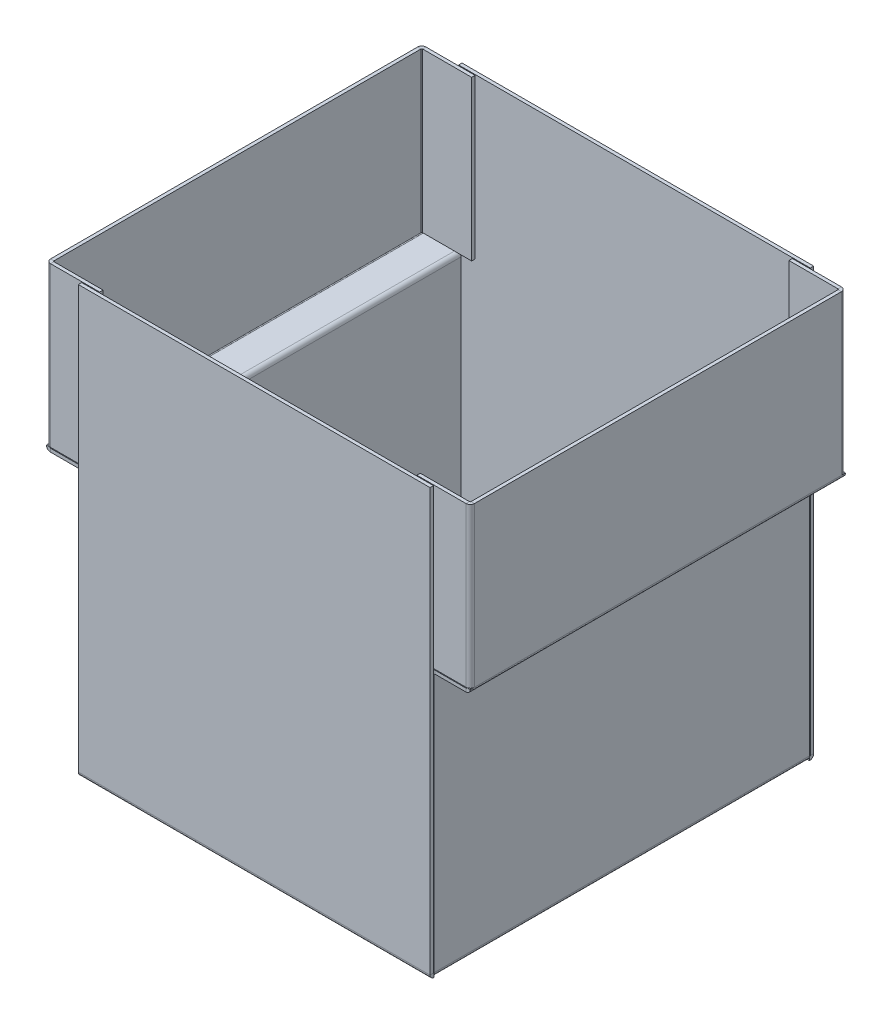
from build123d import *

# Parameters (mm, degrees)
SKETCH6_W                       = 330
SKETCH6_H                       = 360
BASE_FLANGE2_DEPTH              = 3.175
EDGE_FLANGE4_STRIP_W            = 14.1732
EDGE_FLANGE4_STRIP_H            = 3.175
EDGE_FLANGE4_STRIP_CUT_DEPTH    = 330
EDGE_FLANGE4_DEPTH              = 330
EDGE_FLANGE5_STRIP_W            = 14.1732
EDGE_FLANGE5_STRIP_H            = 3.175
EDGE_FLANGE5_STRIP_CUT_DEPTH    = 330
EDGE_FLANGE5_DEPTH              = 330
EDGE_FLANGE6_STRIP_W            = 14.1732
EDGE_FLANGE6_STRIP_H            = 3.175
EDGE_FLANGE6_STRIP_CUT_DEPTH    = 352.1768
EDGE_FLANGE6_DEPTH              = 352.1768
EDGE_FLANGE7_STRIP_W            = 14.1732
EDGE_FLANGE7_STRIP_H            = 3.175
EDGE_FLANGE7_STRIP_CUT_DEPTH    = 352.1768
EDGE_FLANGE7_DEPTH              = 352.1768
EDGE_FLANGE10_STRIP_W           = 14.1732
EDGE_FLANGE10_STRIP_H           = 3.175
EDGE_FLANGE10_STRIP_CUT_DEPTH   = 352.1768
EDGE_FLANGE10_DEPTH             = 352.1768
EDGE_FLANGE11_STRIP_W           = 14.1732
EDGE_FLANGE11_STRIP_H           = 3.175
EDGE_FLANGE11_STRIP_CUT_DEPTH   = 352.1768
EDGE_FLANGE11_DEPTH             = 352.1768
EDGE_FLANGE12_STRIP_W           = 14.1732
EDGE_FLANGE12_STRIP_H           = 3.175
EDGE_FLANGE12_STRIP_CUT_DEPTH   = 352.1768
EDGE_FLANGE12_DEPTH             = 352.1768
EDGE_FLANGE13_STRIP_W           = 14.1732
EDGE_FLANGE13_STRIP_H           = 3.175
EDGE_FLANGE13_STRIP_CUT_DEPTH   = 352.1768
EDGE_FLANGE13_DEPTH             = 352.1768
EDGE_FLANGE14_STRIP_W           = 14.1732
EDGE_FLANGE14_STRIP_H           = 3.175
EDGE_FLANGE14_STRIP_CUT_DEPTH   = 149.2684
EDGE_FLANGE14_STRIP_2_W         = 14.1732
EDGE_FLANGE14_STRIP_2_H         = 3.175
EDGE_FLANGE14_STRIP_CUT_2_DEPTH = 149.2684
EDGE_FLANGE14_STRIP_3_W         = 14.1732
EDGE_FLANGE14_STRIP_3_H         = 3.175
EDGE_FLANGE14_STRIP_CUT_3_DEPTH = 149.2684
EDGE_FLANGE14_STRIP_4_W         = 14.1732
EDGE_FLANGE14_STRIP_4_H         = 3.175
EDGE_FLANGE14_STRIP_CUT_4_DEPTH = 149.2684
EDGE_FLANGE14_DEPTH             = 149.2684
EDGE_FLANGE14_BEND_DEPTH        = 149.2684
EDGE_FLANGE14_BEND_2_DEPTH      = 149.2684
EDGE_FLANGE14_BEND_3_DEPTH      = 149.2684


# Sheet-metal steps are written as plain solids
with BuildPart() as part:
    # Sketch6 → Base-Flange2 (new body)
    with BuildSketch(Plane(origin=(0, 0, 0), x_dir=(1, 0, 0), z_dir=(0, 1, 0))):
        Rectangle(SKETCH6_W, SKETCH6_H)
    extrude(amount=-BASE_FLANGE2_DEPTH)

    # Edge-Flange4 strip (across the edge) → Edge-Flange4 strip cut (cut)
    with BuildSketch(Plane(origin=(-165, 0, 180), x_dir=(0, 0, -1), z_dir=(1, 0, 0))):
        with Locations((-3.175, -1.5875)):
            Rectangle(EDGE_FLANGE4_STRIP_W, EDGE_FLANGE4_STRIP_H)
    extrude(amount=EDGE_FLANGE4_STRIP_CUT_DEPTH, mode=Mode.SUBTRACT)

    # Edge-Flange4 section (across the edge) → Edge-Flange4 (add)
    with BuildSketch(Plane(origin=(-165, 0, 180), x_dir=(0, 0, -1), z_dir=(1, 0, 0))):
        with BuildLine():
            Line((0, 0.7366), (0, 396.825))
            Line((0, 396.825), (3.175, 396.825))
            Line((3.175, 396.825), (3.175, 0.7366))
            ThreePointArc((3.175, 0.7366), (3.390745145, 0.215745145), (3.9116, 0))
            Line((3.9116, 0), (3.9116, -3.175))
            ThreePointArc((3.9116, -3.175), (1.145681115, -2.029318885), (0, 0.7366))
        make_face()
    extrude(amount=EDGE_FLANGE4_DEPTH)

    # Edge-Flange5 strip (across the edge) → Edge-Flange5 strip cut (cut)
    with BuildSketch(Plane(origin=(165, 0, -180), x_dir=(0, 0, 1), z_dir=(-1, 0, 0))):
        with Locations((-3.175, -1.5875)):
            Rectangle(EDGE_FLANGE5_STRIP_W, EDGE_FLANGE5_STRIP_H)
    extrude(amount=EDGE_FLANGE5_STRIP_CUT_DEPTH, mode=Mode.SUBTRACT)

    # Edge-Flange5 section (across the edge) → Edge-Flange5 (add)
    with BuildSketch(Plane(origin=(165, 0, -180), x_dir=(0, 0, 1), z_dir=(-1, 0, 0))):
        with BuildLine():
            Line((0, 0.7366), (0, 396.825))
            Line((0, 396.825), (3.175, 396.825))
            Line((3.175, 396.825), (3.175, 0.7366))
            ThreePointArc((3.175, 0.7366), (3.390745145, 0.215745145), (3.9116, 0))
            Line((3.9116, 0), (3.9116, -3.175))
            ThreePointArc((3.9116, -3.175), (1.145681115, -2.029318885), (0, 0.7366))
        make_face()
    extrude(amount=EDGE_FLANGE5_DEPTH)

    # Edge-Flange6 strip (across the edge) → Edge-Flange6 strip cut (cut)
    with BuildSketch(Plane(origin=(165, 0, 176.0884), x_dir=(-1, 0, 0), z_dir=(0, 0, -1))):
        with Locations((-3.175, -1.5875)):
            Rectangle(EDGE_FLANGE6_STRIP_W, EDGE_FLANGE6_STRIP_H)
    extrude(amount=EDGE_FLANGE6_STRIP_CUT_DEPTH, mode=Mode.SUBTRACT)

    # Edge-Flange6 section (across the edge) → Edge-Flange6 (add)
    with BuildSketch(Plane(origin=(165, 0, 176.0884), x_dir=(-1, 0, 0), z_dir=(0, 0, -1))):
        with BuildLine():
            Line((0, 0.7366), (0, 246.825))
            Line((0, 246.825), (3.175, 246.825))
            Line((3.175, 246.825), (3.175, 0.7366))
            ThreePointArc((3.175, 0.7366), (3.390745145, 0.215745145), (3.9116, 0))
            Line((3.9116, 0), (3.9116, -3.175))
            ThreePointArc((3.9116, -3.175), (1.145681115, -2.029318885), (0, 0.7366))
        make_face()
    extrude(amount=EDGE_FLANGE6_DEPTH)

    # Edge-Flange7 strip (across the edge) → Edge-Flange7 strip cut (cut)
    with BuildSketch(Plane(origin=(-165, 0, -176.0884), x_dir=(1, 0, 0), z_dir=(0, 0, 1))):
        with Locations((-3.175, -1.5875)):
            Rectangle(EDGE_FLANGE7_STRIP_W, EDGE_FLANGE7_STRIP_H)
    extrude(amount=EDGE_FLANGE7_STRIP_CUT_DEPTH, mode=Mode.SUBTRACT)

    # Edge-Flange7 section (across the edge) → Edge-Flange7 (add)
    with BuildSketch(Plane(origin=(-165, 0, -176.0884), x_dir=(1, 0, 0), z_dir=(0, 0, 1))):
        with BuildLine():
            Line((0, 0.7366), (0, 246.825))
            Line((0, 246.825), (3.175, 246.825))
            Line((3.175, 246.825), (3.175, 0.7366))
            ThreePointArc((3.175, 0.7366), (3.390745145, 0.215745145), (3.9116, 0))
            Line((3.9116, 0), (3.9116, -3.175))
            ThreePointArc((3.9116, -3.175), (1.145681115, -2.029318885), (0, 0.7366))
        make_face()
    extrude(amount=EDGE_FLANGE7_DEPTH)

    # Edge-Flange10 strip (across the edge) → Edge-Flange10 strip cut (cut)
    with BuildSketch(Plane(origin=(-165, 246.825, 176.0884), x_dir=(0, -1, 0), z_dir=(0, 0, -1))):
        with Locations((-3.175, -1.5875)):
            Rectangle(EDGE_FLANGE10_STRIP_W, EDGE_FLANGE10_STRIP_H)
    extrude(amount=EDGE_FLANGE10_STRIP_CUT_DEPTH, mode=Mode.SUBTRACT)

    # Edge-Flange10 section (across the edge) → Edge-Flange10 (add)
    with BuildSketch(Plane(origin=(-165, 246.825, 176.0884), x_dir=(0, -1, 0), z_dir=(0, 0, -1))):
        with BuildLine():
            Line((0, 0.7366), (0, 33.825))
            Line((0, 33.825), (3.175, 33.825))
            Line((3.175, 33.825), (3.175, 0.7366))
            ThreePointArc((3.175, 0.7366), (3.390745145, 0.215745145), (3.9116, 0))
            Line((3.9116, 0), (3.9116, -3.175))
            ThreePointArc((3.9116, -3.175), (1.145681115, -2.029318885), (0, 0.7366))
        make_face()
    extrude(amount=EDGE_FLANGE10_DEPTH)

    # Edge-Flange11 strip (across the edge) → Edge-Flange11 strip cut (cut)
    with BuildSketch(Plane(origin=(165, 246.825, -176.0884), x_dir=(0, -1, 0), z_dir=(0, 0, 1))):
        with Locations((-3.175, -1.5875)):
            Rectangle(EDGE_FLANGE11_STRIP_W, EDGE_FLANGE11_STRIP_H)
    extrude(amount=EDGE_FLANGE11_STRIP_CUT_DEPTH, mode=Mode.SUBTRACT)

    # Edge-Flange11 section (across the edge) → Edge-Flange11 (add)
    with BuildSketch(Plane(origin=(165, 246.825, -176.0884), x_dir=(0, -1, 0), z_dir=(0, 0, 1))):
        with BuildLine():
            Line((0, 0.7366), (0, 33.825))
            Line((0, 33.825), (3.175, 33.825))
            Line((3.175, 33.825), (3.175, 0.7366))
            ThreePointArc((3.175, 0.7366), (3.390745145, 0.215745145), (3.9116, 0))
            Line((3.9116, 0), (3.9116, -3.175))
            ThreePointArc((3.9116, -3.175), (1.145681115, -2.029318885), (0, 0.7366))
        make_face()
    extrude(amount=EDGE_FLANGE11_DEPTH)

    # Edge-Flange12 strip (across the edge) → Edge-Flange12 strip cut (cut)
    with BuildSketch(Plane(origin=(-198.825, 246.825, -176.0884), x_dir=(1, 0, 0), z_dir=(0, 0, 1))):
        with Locations((-3.175, -1.5875)):
            Rectangle(EDGE_FLANGE12_STRIP_W, EDGE_FLANGE12_STRIP_H)
    extrude(amount=EDGE_FLANGE12_STRIP_CUT_DEPTH, mode=Mode.SUBTRACT)

    # Edge-Flange12 section (across the edge) → Edge-Flange12 (add)
    with BuildSketch(Plane(origin=(-198.825, 246.825, -176.0884), x_dir=(1, 0, 0), z_dir=(0, 0, 1))):
        with BuildLine():
            Line((0, 0.7366), (0, 150.005))
            Line((0, 150.005), (3.175, 150.005))
            Line((3.175, 150.005), (3.175, 0.7366))
            ThreePointArc((3.175, 0.7366), (3.390745145, 0.215745145), (3.9116, 0))
            Line((3.9116, 0), (3.9116, -3.175))
            ThreePointArc((3.9116, -3.175), (1.145681115, -2.029318885), (0, 0.7366))
        make_face()
    extrude(amount=EDGE_FLANGE12_DEPTH)

    # Edge-Flange13 strip (across the edge) → Edge-Flange13 strip cut (cut)
    with BuildSketch(Plane(origin=(198.825, 246.825, 176.0884), x_dir=(-1, 0, 0), z_dir=(0, 0, -1))):
        with Locations((-3.175, -1.5875)):
            Rectangle(EDGE_FLANGE13_STRIP_W, EDGE_FLANGE13_STRIP_H)
    extrude(amount=EDGE_FLANGE13_STRIP_CUT_DEPTH, mode=Mode.SUBTRACT)

    # Edge-Flange13 section (across the edge) → Edge-Flange13 (add)
    with BuildSketch(Plane(origin=(198.825, 246.825, 176.0884), x_dir=(-1, 0, 0), z_dir=(0, 0, -1))):
        with BuildLine():
            Line((0, 0.7366), (0, 150.005))
            Line((0, 150.005), (3.175, 150.005))
            Line((3.175, 150.005), (3.175, 0.7366))
            ThreePointArc((3.175, 0.7366), (3.390745145, 0.215745145), (3.9116, 0))
            Line((3.9116, 0), (3.9116, -3.175))
            ThreePointArc((3.9116, -3.175), (1.145681115, -2.029318885), (0, 0.7366))
        make_face()
    extrude(amount=EDGE_FLANGE13_DEPTH)

    # Edge-Flange14 strip (across the edge) → Edge-Flange14 strip cut (cut)
    with BuildSketch(Plane(origin=(-195.65, 396.83, 176.0884), x_dir=(0, 0, -1), z_dir=(0, -1, 0))):
        with Locations((-3.175, -1.5875)):
            Rectangle(EDGE_FLANGE14_STRIP_W, EDGE_FLANGE14_STRIP_H)
    extrude(amount=EDGE_FLANGE14_STRIP_CUT_DEPTH, mode=Mode.SUBTRACT)

    # Edge-Flange14 strip 2 (across the edge) → Edge-Flange14 strip cut 2 (cut)
    with BuildSketch(Plane(origin=(-195.65, 247.5616, -176.0884), x_dir=(0, 0, 1), z_dir=(0, 1, 0))):
        with Locations((-3.175, -1.5875)):
            Rectangle(EDGE_FLANGE14_STRIP_2_W, EDGE_FLANGE14_STRIP_2_H)
    extrude(amount=EDGE_FLANGE14_STRIP_CUT_2_DEPTH, mode=Mode.SUBTRACT)

    # Edge-Flange14 strip 3 (across the edge) → Edge-Flange14 strip cut 3 (cut)
    with BuildSketch(Plane(origin=(195.65, 396.83, -176.0884), x_dir=(0, 0, 1), z_dir=(0, -1, 0))):
        with Locations((-3.175, -1.5875)):
            Rectangle(EDGE_FLANGE14_STRIP_3_W, EDGE_FLANGE14_STRIP_3_H)
    extrude(amount=EDGE_FLANGE14_STRIP_CUT_3_DEPTH, mode=Mode.SUBTRACT)

    # Edge-Flange14 strip 4 (across the edge) → Edge-Flange14 strip cut 4 (cut)
    with BuildSketch(Plane(origin=(195.65, 247.5616, 176.0884), x_dir=(0, 0, -1), z_dir=(0, 1, 0))):
        with Locations((-3.175, -1.5875)):
            Rectangle(EDGE_FLANGE14_STRIP_4_W, EDGE_FLANGE14_STRIP_4_H)
    extrude(amount=EDGE_FLANGE14_STRIP_CUT_4_DEPTH, mode=Mode.SUBTRACT)

    # Edge-Flange14 section (across the edge) → Edge-Flange14 (add)
    with BuildSketch(Plane(origin=(-195.65, 396.83, 176.0884), x_dir=(0, 0, -1), z_dir=(0, -1, 0))):
        with BuildLine():
            Line((0, 0.7366), (0, 46.825))
            Line((0, 46.825), (3.175, 46.825))
            Line((3.175, 46.825), (3.175, 0.7366))
            ThreePointArc((3.175, 0.7366), (3.390745145, 0.215745145), (3.9116, 0))
            Line((3.9116, 0), (3.9116, -3.175))
            ThreePointArc((3.9116, -3.175), (1.145681115, -2.029318885), (0, 0.7366))
        make_face()
    extrude(amount=EDGE_FLANGE14_DEPTH)

    # Edge-Flange14 section 2 (across the edge) → Edge-Flange14 bend (add)
    with BuildSketch(Plane(origin=(-195.65, 247.5616, -176.0884), x_dir=(0, 0, 1), z_dir=(0, 1, 0))):
        with BuildLine():
            Line((0, 0.7366), (0, 46.825))
            Line((0, 46.825), (3.175, 46.825))
            Line((3.175, 46.825), (3.175, 0.7366))
            ThreePointArc((3.175, 0.7366), (3.390745145, 0.215745145), (3.9116, 0))
            Line((3.9116, 0), (3.9116, -3.175))
            ThreePointArc((3.9116, -3.175), (1.145681115, -2.029318885), (0, 0.7366))
        make_face()
    extrude(amount=EDGE_FLANGE14_BEND_DEPTH)

    # Edge-Flange14 section 3 (across the edge) → Edge-Flange14 bend 2 (add)
    with BuildSketch(Plane(origin=(195.65, 396.83, -176.0884), x_dir=(0, 0, 1), z_dir=(0, -1, 0))):
        with BuildLine():
            Line((0, 0.7366), (0, 46.825))
            Line((0, 46.825), (3.175, 46.825))
            Line((3.175, 46.825), (3.175, 0.7366))
            ThreePointArc((3.175, 0.7366), (3.390745145, 0.215745145), (3.9116, 0))
            Line((3.9116, 0), (3.9116, -3.175))
            ThreePointArc((3.9116, -3.175), (1.145681115, -2.029318885), (0, 0.7366))
        make_face()
    extrude(amount=EDGE_FLANGE14_BEND_2_DEPTH)

    # Edge-Flange14 section 4 (across the edge) → Edge-Flange14 bend 3 (add)
    with BuildSketch(Plane(origin=(195.65, 247.5616, 176.0884), x_dir=(0, 0, -1), z_dir=(0, 1, 0))):
        with BuildLine():
            Line((0, 0.7366), (0, 46.825))
            Line((0, 46.825), (3.175, 46.825))
            Line((3.175, 46.825), (3.175, 0.7366))
            ThreePointArc((3.175, 0.7366), (3.390745145, 0.215745145), (3.9116, 0))
            Line((3.9116, 0), (3.9116, -3.175))
            ThreePointArc((3.9116, -3.175), (1.145681115, -2.029318885), (0, 0.7366))
        make_face()
    extrude(amount=EDGE_FLANGE14_BEND_3_DEPTH)


solid = part.part
